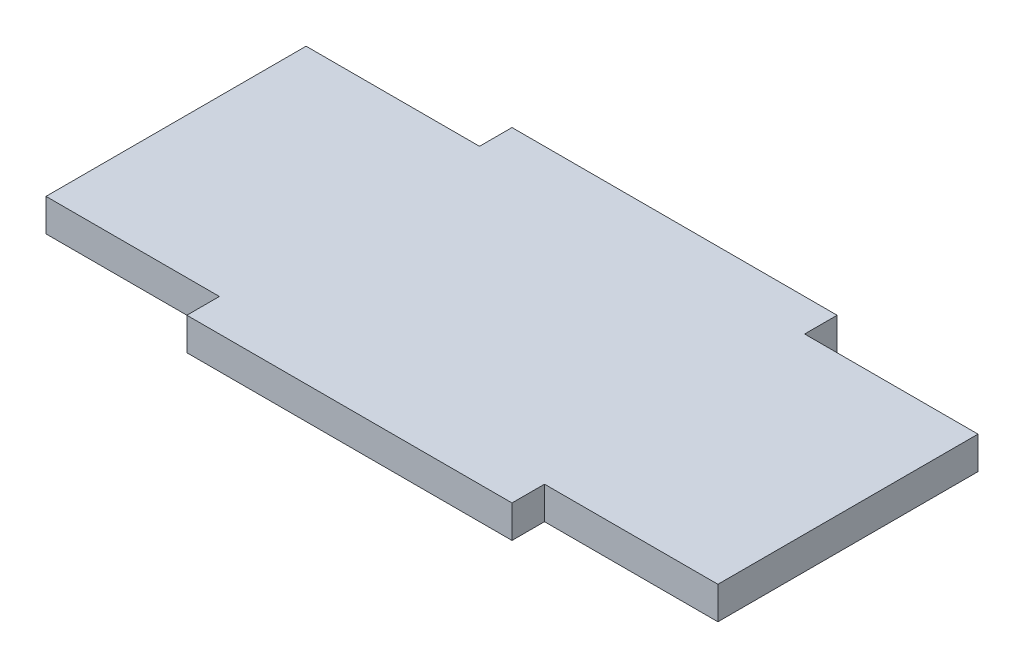
from build123d import *

# Parameters (mm, degrees)
SALIENTE_EXTRUIR1_DEPTH = 3


with BuildPart() as part:
    # Croquis1 → Saliente-Extruir1 (new body)
    with BuildSketch(Plane(origin=(0, 0, 0), x_dir=(1, 0, 0), z_dir=(0, 1, 0))):
        Polygon((0, 0), (16, 0), (16, -3), (46, -3), (46, 0), (62, 0), (62, 24), (46, 24), (46, 27), (16, 27), (16, 24), (0, 24), align=None)
    extrude(amount=SALIENTE_EXTRUIR1_DEPTH)


solid = part.part
